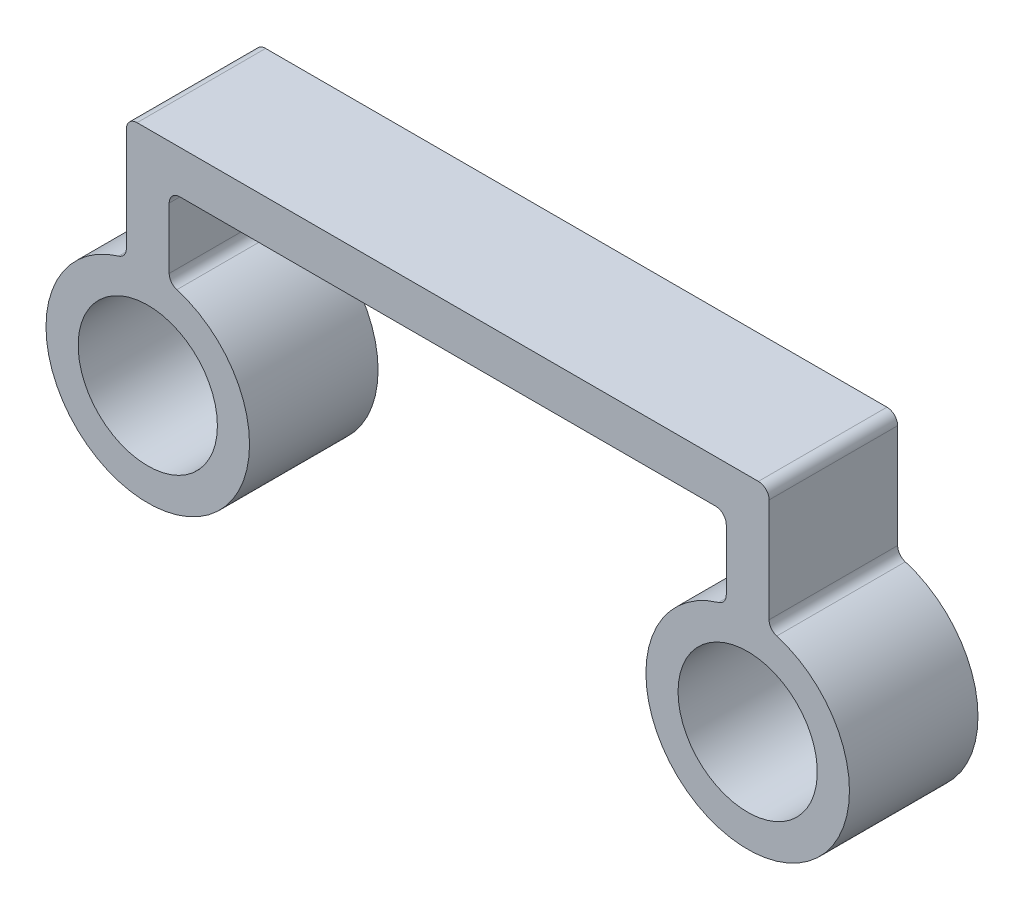
from build123d import *

# Parameters (mm, degrees)
SKETCH1_R           = 6.5
BOSS_EXTRUDE1_DEPTH = 12
FILLET1_R           = 1


with BuildPart() as part:
    # Sketch1 → Boss-Extrude1 (new body)
    with BuildSketch(Plane.XY):
        with BuildLine():
            Line((-26, 9.287087811), (-26, 16.75))
            Line((-26, 16.75), (0, 16.75))
            Line((0, 16.75), (0, 20.75))
            Line((0, 20.75), (-30, 20.75))
            Line((-30, 20.75), (-30, 9.287087811))
            ThreePointArc((-30, 9.287087811), (-28, -9.5), (-26, 9.287087811))
        make_face()
        with Locations((-28, 0)):
            Circle(SKETCH1_R, mode=Mode.SUBTRACT)
    boss_extrude1 = extrude(amount=BOSS_EXTRUDE1_DEPTH)

    # Mirror1: Boss-Extrude1 across plane
    add(boss_extrude1.mirror(Plane(origin=(0, 0, 0), x_dir=(0, 0, 1), z_dir=(1, 0, 0))))

    # Fillet1
    fillet1_edges = [part.edges().sort_by_distance(p)[0] for p in [
        (-30, 9.287087811, 6),
        (-26, 9.287087811, 6),
        (26, 9.287087811, 6),
        (30, 9.287087811, 6),
        (26, 16.75, 6),
        (-26, 16.75, 6),
        (-30, 20.75, 6),
        (30, 20.75, 6),
    ]]
    fillet(fillet1_edges, radius=FILLET1_R)


solid = part.part
